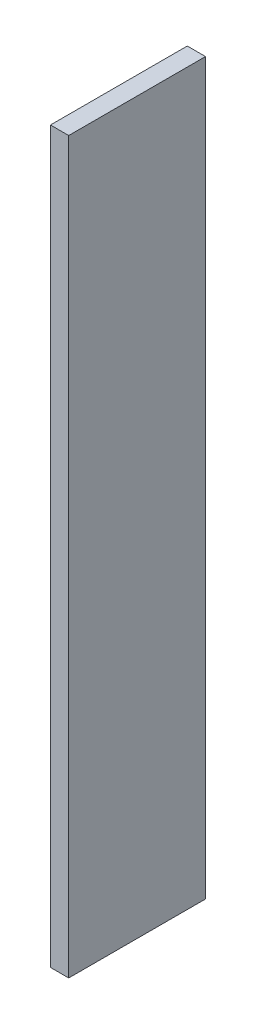
from build123d import *

# Parameters (mm, degrees)
SKETCH1_W           = 0.4
SKETCH1_H           = 16
BOSS_EXTRUDE1_DEPTH = 3


with BuildPart() as part:
    # Sketch1 → Boss-Extrude1 (new body)
    with BuildSketch(Plane.XY):
        with Locations((0.2, 8)):
            Rectangle(SKETCH1_W, SKETCH1_H)
    extrude(amount=BOSS_EXTRUDE1_DEPTH)


solid = part.part
